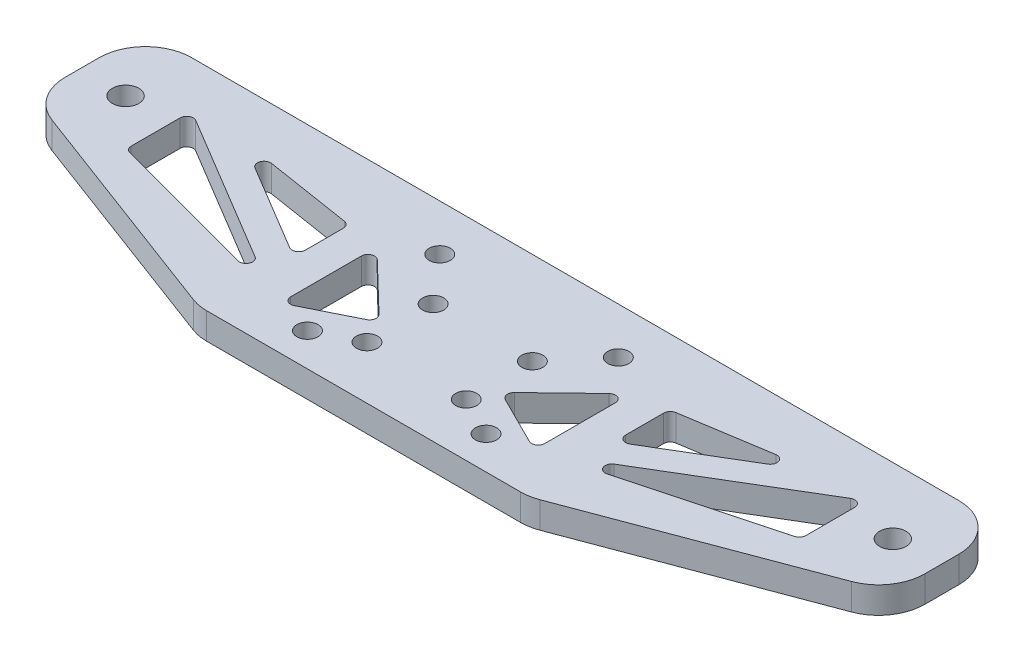
from build123d import *

# Parameters (mm, degrees)
EXTRUDE_1_DEPTH     = 4
SKETCH_2_R          = 1.6
CUT_EXTRUDE_1_DEPTH = 72.700767081
SKETCH_3_R          = 2
SKETCH_3_R_2        = 1.6
CUT_EXTRUDE_2_DEPTH = 72.700767081
SKETCH_4_W          = 130
SKETCH_4_H          = 2
EXTRUDE_2_DEPTH     = 4
FILLET_1_R          = 7


with BuildPart() as part:
    # 草图1 → 凸台-拉伸1 (new body)
    with BuildSketch(Plane(origin=(0, 0, 0), x_dir=(1, 0, 0), z_dir=(0, 1, 0))):
        Polygon((25, 0), (-25, 0), (-65, 15), (-65, 30), (65, 30), (65, 15), align=None)
    extrude(amount=EXTRUDE_1_DEPTH)

    # 草图2 → 切除-拉伸1 (cut, through all)
    with BuildSketch(Plane(origin=(0, 4, 0), x_dir=(1, 0, 0), z_dir=(0, 1, 0))):
        with Locations((-7.5, 18)):
            Circle(SKETCH_2_R)
        with Locations((7.5, 18)):
            Circle(SKETCH_2_R)
        with Locations((-7.5, 8)):
            Circle(SKETCH_2_R)
        with Locations((7.5, 8)):
            Circle(SKETCH_2_R)
    extrude(amount=-CUT_EXTRUDE_1_DEPTH, mode=Mode.SUBTRACT)

    # 草图3 → 切除-拉伸2 (cut, through all)
    with BuildSketch(Plane(origin=(0, 4, 0), x_dir=(1, 0, 0), z_dir=(0, 1, 0))):
        with Locations((-58, 22)):
            Circle(SKETCH_3_R)
        with Locations((58, 22)):
            Circle(SKETCH_3_R)
        with Locations((-13.5, 5)):
            Circle(SKETCH_3_R_2)
        with Locations((-13.5, 25)):
            Circle(SKETCH_3_R_2)
        with Locations((13.5, 5)):
            Circle(SKETCH_3_R_2)
        with Locations((13.5, 25)):
            Circle(SKETCH_3_R_2)
        with BuildLine():
            Line((-51, 23.236030392), (-51, 15.857143498))
            ThreePointArc((-51, 15.857143498), (-50.793424544, 15.248474875), (-50.259045015, 14.891278248))
            Line((-50.259045015, 14.891278248), (-27.921339757, 8.900306744))
            ThreePointArc((-27.921339757, 8.900306744), (-26.741501421, 9.476121152), (-27.148724711, 10.724219675))
            Line((-27.148724711, 10.724219675), (-49.486429968, 24.094078073))
            ThreePointArc((-49.486429968, 24.094078073), (-50.493168312, 24.105964306), (-51, 23.236030392))
        make_face()
        with BuildLine():
            Line((-38.782523044, 22.349179917), (-25.724953573, 14.533790966))
            ThreePointArc((-25.724953573, 14.533790966), (-24.718215229, 14.521904732), (-24.211383541, 15.391838647))
            Line((-24.211383541, 15.391838647), (-24.211383541, 21.145506102))
            ThreePointArc((-24.211383541, 21.145506102), (-24.451132736, 21.795135776), (-25.055420968, 22.133269067))
            Line((-25.055420968, 22.133269067), (-38.112990439, 24.194990563))
            ThreePointArc((-38.112990439, 24.194990563), (-39.209019504, 23.548218787), (-38.782523044, 22.349179917))
        make_face()
        with BuildLine():
            Line((-10.229137867, 12.546046067), (-17.517122215, 19.57620297))
            ThreePointArc((-17.517122215, 19.57620297), (-18.602368626, 19.776876975), (-19.211383541, 18.856479961))
            Line((-19.211383541, 18.856479961), (-19.211383541, 8.182330884))
            ThreePointArc((-19.211383541, 8.182330884), (-18.737114654, 7.331680075), (-17.764169946, 7.287903693))
            Line((-17.764169946, 7.287903693), (-10.476185598, 10.931895866))
            ThreePointArc((-10.476185598, 10.931895866), (-9.934909706, 11.67503349), (-10.229137867, 12.546046067))
        make_face()
        with BuildLine():
            Line((17.764169946, 7.287903693), (10.476185598, 10.931895866))
            ThreePointArc((10.476185598, 10.931895866), (9.934909706, 11.67503349), (10.229137867, 12.546046067))
            Line((10.229137867, 12.546046067), (17.517122215, 19.57620297))
            ThreePointArc((17.517122215, 19.57620297), (18.602368626, 19.776876975), (19.211383541, 18.856479961))
            Line((19.211383541, 18.856479961), (19.211383541, 8.182330884))
            ThreePointArc((19.211383541, 8.182330884), (18.737114654, 7.331680075), (17.764169946, 7.287903693))
        make_face()
        with BuildLine():
            Line((25.055420968, 22.133269067), (38.112990439, 24.194990563))
            ThreePointArc((38.112990439, 24.194990563), (39.209019504, 23.548218787), (38.782523044, 22.349179917))
            Line((38.782523044, 22.349179917), (25.724953573, 14.533790966))
            ThreePointArc((25.724953573, 14.533790966), (24.718215229, 14.521904732), (24.211383541, 15.391838647))
            Line((24.211383541, 15.391838647), (24.211383541, 21.145506102))
            ThreePointArc((24.211383541, 21.145506102), (24.451132736, 21.795135776), (25.055420968, 22.133269067))
        make_face()
        with BuildLine():
            Line((27.148724711, 10.724219675), (49.486429968, 24.094078073))
            ThreePointArc((49.486429968, 24.094078073), (50.493168312, 24.105964306), (51, 23.236030392))
            Line((51, 23.236030392), (51, 15.857143498))
            ThreePointArc((51, 15.857143498), (50.793424544, 15.248474875), (50.259045015, 14.891278248))
            Line((50.259045015, 14.891278248), (27.921339757, 8.900306744))
            ThreePointArc((27.921339757, 8.900306744), (26.741501421, 9.476121152), (27.148724711, 10.724219675))
        make_face()
    extrude(amount=-CUT_EXTRUDE_2_DEPTH, mode=Mode.SUBTRACT)

    # 草图4 → 凸台-拉伸2 (add)
    with BuildSketch(Plane(origin=(0, 4, 0), x_dir=(1, 0, 0), z_dir=(0, 1, 0))):
        with Locations((0, 31)):
            Rectangle(SKETCH_4_W, SKETCH_4_H)
    extrude(amount=-EXTRUDE_2_DEPTH)

    # 圆角1
    fillet_1_edges = [part.edges().sort_by_distance(p)[0] for p in [
        (-25, 2, 0),
        (25, 2, 0),
        (65, 2, -15),
        (-65, 2, -15),
        (65, 2, -32),
        (-65, 2, -32),
    ]]
    fillet(fillet_1_edges, radius=FILLET_1_R)


solid = part.part
